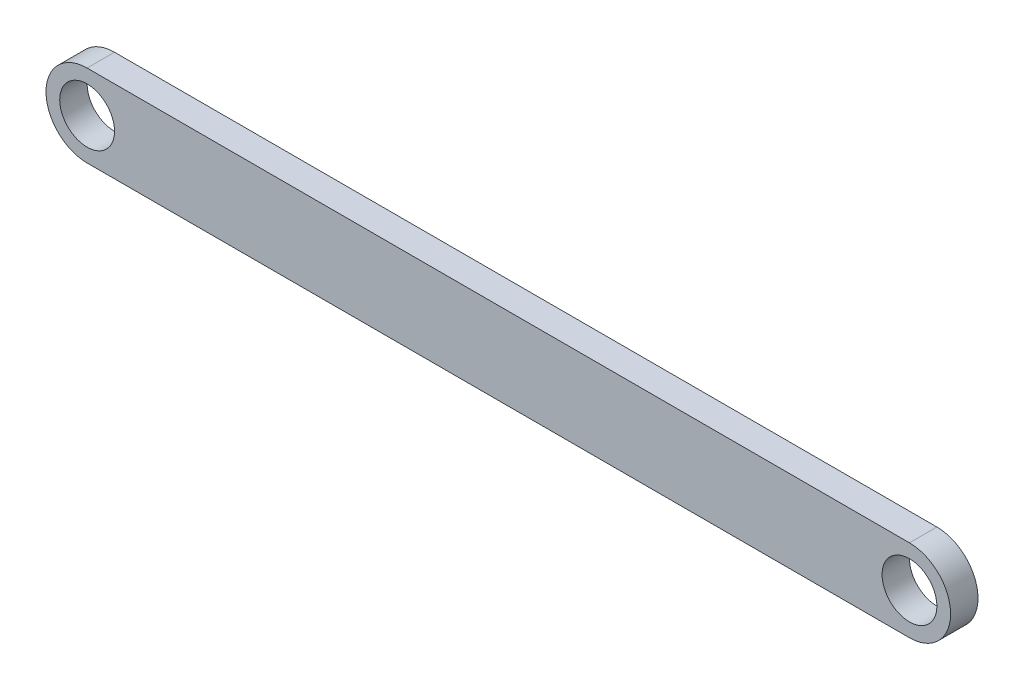
from build123d import *

# Parameters (mm, degrees)
SKETCH1_R           = 5
BOSS_EXTRUDE1_DEPTH = 5


with BuildPart() as part:
    # Sketch1 → Boss-Extrude1 (new body)
    with BuildSketch(Plane.XY):
        with BuildLine():
            Line((75, -7.5), (-75, -7.5))
            ThreePointArc((-75, -7.5), (-82.5, 0), (-75, 7.5))
            Line((-75, 7.5), (75, 7.5))
            ThreePointArc((75, 7.5), (82.5, 0), (75, -7.5))
        make_face()
        with Locations((75, 0)):
            Circle(SKETCH1_R, mode=Mode.SUBTRACT)
        with Locations((-75, 0)):
            Circle(SKETCH1_R, mode=Mode.SUBTRACT)
    extrude(amount=BOSS_EXTRUDE1_DEPTH)


solid = part.part
